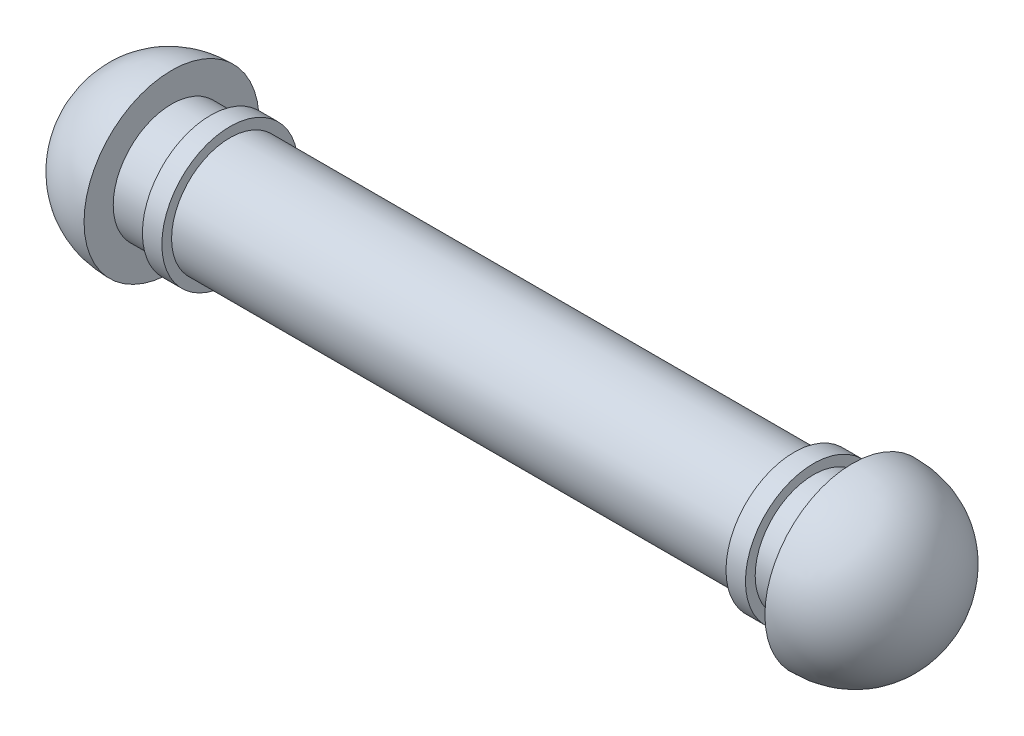
from build123d import *

# Parameters (mm, degrees)
SKETCH1_R           = 30
BOSS_EXTRUDE1_DEPTH = 175
SKETCH3_W           = 10
SKETCH3_H           = 35


with BuildPart() as part:
    # Sketch1 → Boss-Extrude1 (new body)
    with BuildSketch(Plane(origin=(0, 0, 0), x_dir=(0, 0, -1), z_dir=(1, 0, 0))):
        Circle(SKETCH1_R)
    boss_extrude1 = extrude(amount=BOSS_EXTRUDE1_DEPTH)

    # Sketch3 → Revolve1 (revolve)
    with BuildSketch(Plane.XY):
        with Locations((25, 17.5)):
            Rectangle(SKETCH3_W, SKETCH3_H)
        with BuildLine():
            Line((0, 0), (-45.458392513, 0))
            add(Edge.make_bspline(
                [(-45.458392513, 0), (-45.458392513, 20.183781855), (-30.991238831, 45), (0, 45)],
                knots=[0, 0, 0, 0, 1, 1, 1, 1], degree=3))
            Line((0, 45), (0, 0))
        make_face()
    revolve1 = revolve(axis=Axis((-100.078673334, 0, 0), (1, 0, 0)))

    # Mirror1: Boss-Extrude1, Revolve1 across plane
    add(boss_extrude1.mirror(Plane(origin=(175, 0, 0), x_dir=(0, 0, 1), z_dir=(1, 0, 0))))
    add(revolve1.mirror(Plane(origin=(175, 0, 0), x_dir=(0, 0, 1), z_dir=(1, 0, 0))))


solid = part.part
